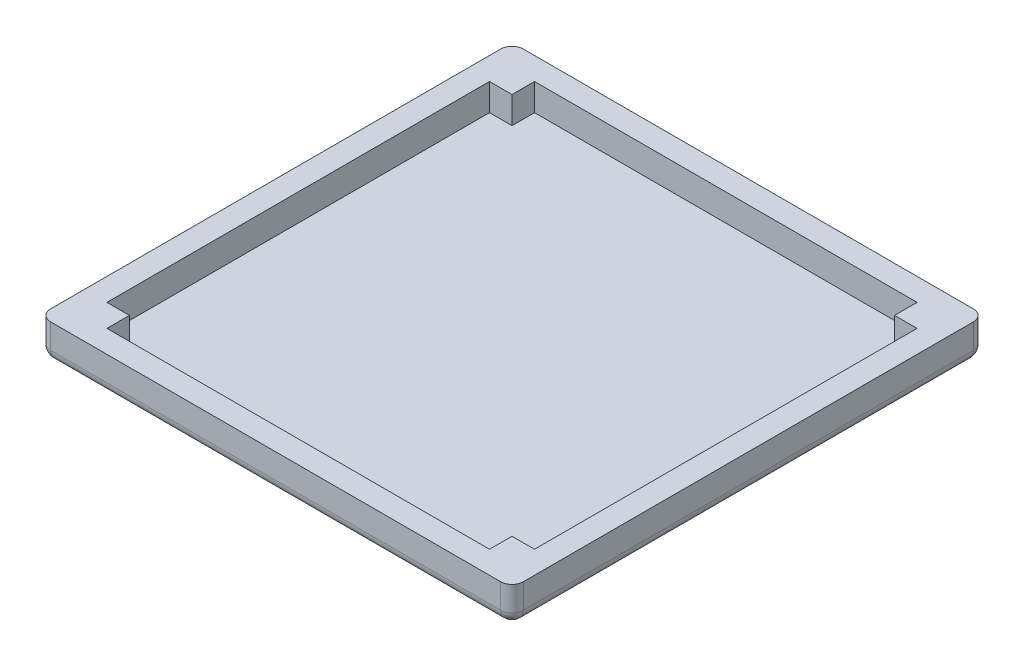
from build123d import *

# Parameters (mm, degrees)
SKETCH1_W          = 210
SKETCH1_H          = 210
BASE_DEPTH         = 16
CUT_EXTRUDE1_DEPTH = 12
FILLET1_R          = 5
FILLET2_R          = 5


with BuildPart() as part:
    # Sketch1 → Base (new body)
    with BuildSketch(Plane(origin=(0, 0, 0), x_dir=(1, 0, 0), z_dir=(0, 1, 0))):
        Rectangle(SKETCH1_W, SKETCH1_H)
    extrude(amount=BASE_DEPTH)

    # Sketch3 → Cut-Extrude1 (cut)
    with BuildSketch(Plane(origin=(0, 16, 0), x_dir=(1, 0, 0), z_dir=(0, 1, 0))):
        Polygon((-85, 95), (85, 95), (85, 85), (95, 85), (95, -85), (85, -85), (85, -95), (-85, -95), (-85, -85), (-95, -85), (-95, 85), (-85, 85), align=None)
    extrude(amount=-CUT_EXTRUDE1_DEPTH, mode=Mode.SUBTRACT)

    # Fillet1
    fillet1_edges = [part.edges().sort_by_distance(p)[0] for p in [
        (0, 0, 105),
        (-105, 0, 0),
        (0, 0, -105),
        (105, 0, 0),
    ]]
    fillet(fillet1_edges, radius=FILLET1_R)

    # Fillet2
    # the kernel refuses this fillet: 5 mm, written as the material it takes off along each edge
    with BuildSketch(Plane(origin=(100, 5, 100), x_dir=(1, 0, 0), z_dir=(0, 0, 1))) as fillet2_piece_1_section:
        Polygon((0, 0), (FILLET2_R, 0), (FILLET2_R, -FILLET2_R), (0, -FILLET2_R), align=None)
    fillet2_piece_1 = extrude(amount=FILLET2_R, mode=Mode.PRIVATE)
    fillet2_piece_1 = fillet2_piece_1 - Plane(origin=(100, 5, 100), x_dir=(-0.7071067811865475, 0.7071067811865475, 0), z_dir=(0, 0, 1)) * Sphere(FILLET2_R, mode=Mode.PRIVATE)
    add(fillet2_piece_1, mode=Mode.SUBTRACT)
    with BuildSketch(Plane(origin=(-100, 5, 100), x_dir=(-1, 0, 0), z_dir=(0, 0, 1))) as fillet2_piece_2_section:
        Polygon((0, 0), (FILLET2_R, 0), (FILLET2_R, FILLET2_R), (0, FILLET2_R), align=None)
    fillet2_piece_2 = extrude(amount=FILLET2_R, mode=Mode.PRIVATE)
    fillet2_piece_2 = fillet2_piece_2 - Plane(origin=(-100, 5, 100), x_dir=(0.7071067811865475, 0.7071067811865475, 0), z_dir=(0, 0, 1)) * Sphere(FILLET2_R, mode=Mode.PRIVATE)
    add(fillet2_piece_2, mode=Mode.SUBTRACT)
    with BuildSketch(Plane(origin=(100, 5, -100), x_dir=(0, 0, -1), z_dir=(1, 0, 0))) as fillet2_piece_3_section:
        Polygon((0, 0), (FILLET2_R, 0), (FILLET2_R, -FILLET2_R), (0, -FILLET2_R), align=None)
    fillet2_piece_3 = extrude(amount=FILLET2_R, mode=Mode.PRIVATE)
    fillet2_piece_3 = fillet2_piece_3 - Plane(origin=(100, 5, -100), x_dir=(0, 0.7071067811865475, 0.7071067811865475), z_dir=(1, 0, 0)) * Sphere(FILLET2_R, mode=Mode.PRIVATE)
    add(fillet2_piece_3, mode=Mode.SUBTRACT)
    with BuildSketch(Plane(origin=(-100, 5, -100), x_dir=(0, 0, -1), z_dir=(-1, 0, 0))) as fillet2_piece_4_section:
        Polygon((0, 0), (FILLET2_R, 0), (FILLET2_R, FILLET2_R), (0, FILLET2_R), align=None)
    fillet2_piece_4 = extrude(amount=FILLET2_R, mode=Mode.PRIVATE)
    fillet2_piece_4 = fillet2_piece_4 - Plane(origin=(-100, 5, -100), x_dir=(0, 0.7071067811865475, 0.7071067811865475), z_dir=(-1, 0, 0)) * Sphere(FILLET2_R, mode=Mode.PRIVATE)
    add(fillet2_piece_4, mode=Mode.SUBTRACT)
    with BuildSketch(Plane(origin=(105, 5, 105), x_dir=(-1, 0, 0), z_dir=(0, 1, 0)), Plane(origin=(105, 5, -105), x_dir=(0, 0, 1), z_dir=(0, 1, 0))) as fillet2_piece_5:
        with BuildLine():
            CenterArc((FILLET2_R, -FILLET2_R), FILLET2_R, 90, 90)
            Line((0, -FILLET2_R), (0, 0))
            Line((0, 0), (FILLET2_R, 0))
        make_face()
    extrude(amount=23.5, mode=Mode.SUBTRACT)
    with BuildSketch(Plane(origin=(-105, 5, 105), x_dir=(1, 0, 0), z_dir=(0, 1, 0)), Plane(origin=(-105, 5, -105), x_dir=(0, 0, 1), z_dir=(0, 1, 0))) as fillet2_piece_6:
        with BuildLine():
            CenterArc((FILLET2_R, FILLET2_R), FILLET2_R, 180, 90)
            Line((0, FILLET2_R), (0, 0))
            Line((0, 0), (FILLET2_R, 0))
        make_face()
    extrude(amount=23.5, mode=Mode.SUBTRACT)


solid = part.part
